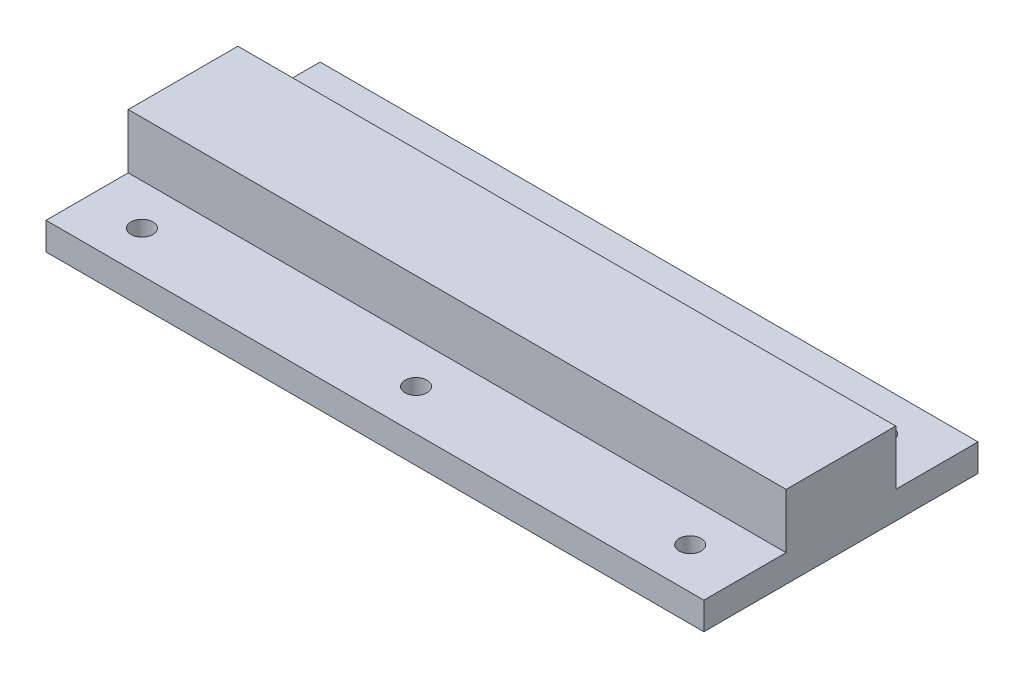
from build123d import *

# Parameters (mm, degrees)
SKETCH2_W                       = 120
SKETCH2_H                       = 50
BOSS_EXTRUDE1_DEPTH             = 15
SKIZZE7_R                       = 1.5
SCHNITT_LINEAR_AUSTRAGEN6_DEPTH = 10
SKIZZE10_W                      = 12.5
SKIZZE10_H                      = 2.5
ROTATION3_ANGLE                 = 180
SKIZZE11_W                      = 12.5
SKIZZE11_H                      = 2.5
ROTATION4_ANGLE                 = 180
SKIZZE12_R                      = 2
SCHNITT_LINEAR_AUSTRAGEN7_DEPTH = 83.233536557
SKIZZE13_W                      = 15
SKIZZE13_H                      = 10
SCHNITT_LINEAR_AUSTRAGEN8_DEPTH = 126.771499808


with BuildPart() as part:
    # Sketch2 → Boss-Extrude1 (new body)
    with BuildSketch(Plane(origin=(0, 0, 0), x_dir=(1, 0, 0), z_dir=(0, 1, 0))):
        with Locations((13.101876656, 9.54663752)):
            Rectangle(SKETCH2_W, SKETCH2_H)
    extrude(amount=BOSS_EXTRUDE1_DEPTH)

    # Skizze7 → Schnitt-Linear austragen6 (cut)
    with BuildSketch(Plane.ZY.offset(46.898123344)):
        with Locations((-9.54663752, 2.5)):
            Circle(SKIZZE7_R)
    extrude(amount=-SCHNITT_LINEAR_AUSTRAGEN6_DEPTH, mode=Mode.SUBTRACT)

    # Sketch3 → Schnitt-Rotation1 (revolve, cut)
    with BuildSketch(Plane(origin=(0, 0, 0), x_dir=(1, 0, 0), z_dir=(0, 1, 0))):
        Polygon((63.101876656, 9.54663752), (63.101876656, 17.04663752), (3.101876656, 17.04663752), (3.101876656, 19.54663752), (-36.898123344, 19.54663752), (-36.898123344, 9.54663752), align=None)
    revolve(axis=Axis((74.354835368, 0, -9.54663752), (-1, 0, 0)), mode=Mode.SUBTRACT)

    # Skizze10 → Rotation3 (revolve)
    with BuildSketch(Plane.XZ):
        with Locations((46.851876656, -15.79663752)):
            Rectangle(SKIZZE10_W, SKIZZE10_H)
    revolve(axis=Axis((85.744816074, 0, -9.54663752), (1, 0, 0)), revolution_arc=ROTATION3_ANGLE)

    # Skizze11 → Rotation4 (revolve)
    with BuildSketch(Plane.XZ):
        with Locations((21.851876656, -15.79663752)):
            Rectangle(SKIZZE11_W, SKIZZE11_H)
    revolve(axis=Axis((95.037830494, 0, -9.54663752), (1, 0, 0)), revolution_arc=ROTATION4_ANGLE)

    # Skizze12 → Schnitt-Linear austragen7 (cut, through all)
    with BuildSketch(Plane.XZ):
        with Locations((-36.898123344, 7.95336248)):
            Circle(SKIZZE12_R)
        with Locations((13.101876656, 7.95336248)):
            Circle(SKIZZE12_R)
        with Locations((63.101876656, 7.95336248)):
            Circle(SKIZZE12_R)
    schnitt_linear_austragen7 = extrude(amount=-SCHNITT_LINEAR_AUSTRAGEN7_DEPTH, mode=Mode.SUBTRACT)

    # Spiegeln1: Schnitt-Linear austragen7 across plane
    add(schnitt_linear_austragen7.mirror(Plane.XY.offset(-9.54663752)), mode=Mode.SUBTRACT)

    # Skizze13 → Schnitt-Linear austragen8 (cut, through all)
    with BuildSketch(Plane.ZY.offset(46.898123344)):
        with Locations((7.95336248, 10)):
            Rectangle(SKIZZE13_W, SKIZZE13_H)
        with Locations((-27.04663752, 10)):
            Rectangle(SKIZZE13_W, SKIZZE13_H)
    extrude(amount=-SCHNITT_LINEAR_AUSTRAGEN8_DEPTH, mode=Mode.SUBTRACT)


solid = part.part
